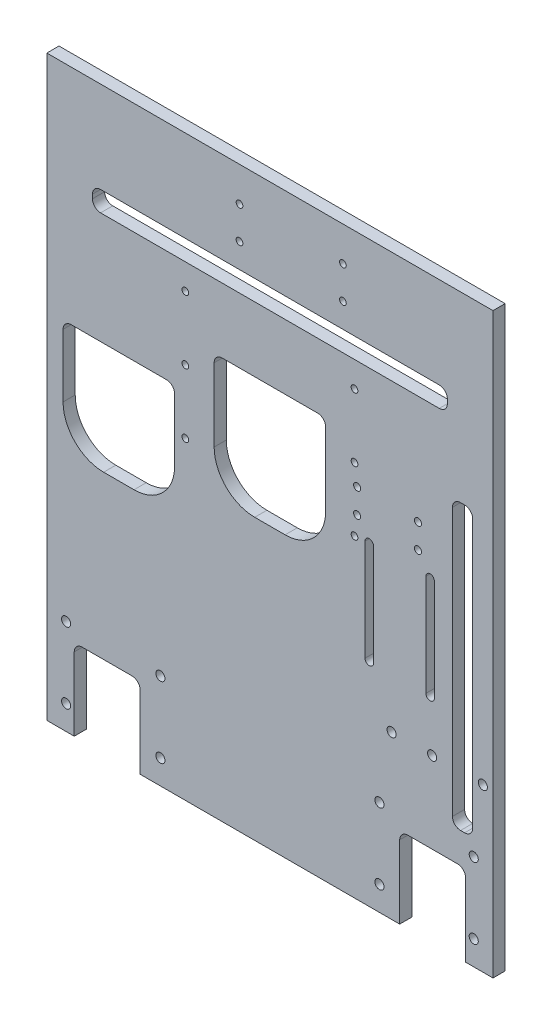
from build123d import *

# Parameters (mm, degrees)
ESQUISSE1_W                  = 220
ESQUISSE1_H                  = 285
BOSS_EXTRU_1_DEPTH           = 6
ESQUISSE2_R                  = 2
ENL_V_MAT_EXTRU_1_DEPTH      = 8
ENL_V_MAT_EXTRU_2_DEPTH      = 361.084712255
ENL_V_MAT_EXTRU_2_DEPTH_BACK = 361.084712255
ESQUISSE3_W                  = 55
ESQUISSE3_H                  = 60
ESQUISSE3_H_2                = 55
ESQUISSE3_W_2                = 10
ESQUISSE3_H_3                = 140
ENL_V_MAT_EXTRU_3_DEPTH      = 361.084712255
ENL_V_MAT_EXTRU_3_DEPTH_BACK = 361.084712255
ESQUISSE5_W                  = 175
ESQUISSE5_H                  = 10
ENL_V_MAT_EXTRU_4_DEPTH      = 361.084712255
ENL_V_MAT_EXTRU_4_DEPTH_BACK = 361.084712255
ESQUISSE6_R                  = 2.25
ESQUISSE6_R_2                = 1.75
ENL_V_MAT_EXTRU_5_DEPTH      = 361.084712255
ENL_V_MAT_EXTRU_5_DEPTH_BACK = 361.084712255
ESQUISSE7_R                  = 1.65
ENL_V_MAT_EXTRU_6_DEPTH      = 361.084712255
ENL_V_MAT_EXTRU_6_DEPTH_BACK = 361.084712255
ESQUISSE8_W                  = 32.5
ESQUISSE8_H                  = 40
CONG_1_R                     = 20
CONG_2_R                     = 4
ENL_V_MAT_EXTRU_7_DEPTH      = 361.084712255
ENL_V_MAT_EXTRU_7_DEPTH_BACK = 361.084712255
ENL_V_MAT_EXTRU_8_DEPTH      = 361.084712255
ENL_V_MAT_EXTRU_8_DEPTH_BACK = 361.084712255
ESQUISSE10_R                 = 2.25


with BuildPart() as part:
    # Esquisse1 → Boss.-Extru.1 (new body)
    with BuildSketch(Plane.XY):
        with Locations((110, 142.5)):
            Rectangle(ESQUISSE1_W, ESQUISSE1_H)
    extrude(amount=BOSS_EXTRU_1_DEPTH)

    # Esquisse2 → Enlèv. mat.-Extru.1 (cut)
    with BuildSketch(Plane.XZ):
        with Locations((110, 3)):
            Circle(ESQUISSE2_R)
        with Locations((213, 3)):
            Circle(ESQUISSE2_R)
        with Locations((7, 3)):
            Circle(ESQUISSE2_R)
    extrude(amount=-ENL_V_MAT_EXTRU_1_DEPTH, mode=Mode.SUBTRACT)

    # Esquisse3 → Enlèv. mat.-Extru.2 (cut, two sides: drawn at the far end of the back side and taken through both)
    with BuildSketch(Plane.XY.offset(6).offset(-ENL_V_MAT_EXTRU_2_DEPTH_BACK)):
        with Locations((110, 168)):
            Rectangle(ESQUISSE3_W, ESQUISSE3_H)
        with Locations((35.5, 147.5)):
            Rectangle(ESQUISSE3_W, ESQUISSE3_H_2)
        with Locations((205, 125)):
            Rectangle(ESQUISSE3_W_2, ESQUISSE3_H_3)
    extrude(amount=ENL_V_MAT_EXTRU_2_DEPTH + ENL_V_MAT_EXTRU_2_DEPTH_BACK, mode=Mode.SUBTRACT)

    # Esquisse5 → Enlèv. mat.-Extru.3 (cut, two sides: drawn at the far end of the back side and taken through both)
    with BuildSketch(Plane.XY.offset(6).offset(-ENL_V_MAT_EXTRU_3_DEPTH_BACK)):
        with Locations((110, 235)):
            Rectangle(ESQUISSE5_W, ESQUISSE5_H)
    extrude(amount=ENL_V_MAT_EXTRU_3_DEPTH + ENL_V_MAT_EXTRU_3_DEPTH_BACK, mode=Mode.SUBTRACT)

    # Esquisse6 → Enlèv. mat.-Extru.4 (cut, two sides: drawn at the far end of the back side and taken through both)
    with BuildSketch(Plane.XY.offset(6).offset(-ENL_V_MAT_EXTRU_4_DEPTH_BACK)):
        with Locations((190, 80)):
            Circle(ESQUISSE6_R)
        with Locations((170, 80)):
            Circle(ESQUISSE6_R)
        with Locations((215, 80)):
            Circle(ESQUISSE6_R)
        with Locations((153, 176.25)):
            Circle(ESQUISSE6_R_2)
        with Locations((183, 176.25)):
            Circle(ESQUISSE6_R_2)
        with Locations((183, 164.25)):
            Circle(ESQUISSE6_R_2)
        with Locations((153, 164.25)):
            Circle(ESQUISSE6_R_2)
    extrude(amount=ENL_V_MAT_EXTRU_4_DEPTH + ENL_V_MAT_EXTRU_4_DEPTH_BACK, mode=Mode.SUBTRACT)

    # Esquisse7 → Enlèv. mat.-Extru.5 (cut, two sides: drawn at the far end of the back side and taken through both)
    with BuildSketch(Plane.XY.offset(6).offset(-ENL_V_MAT_EXTRU_5_DEPTH_BACK)):
        with Locations((68.285, 217.4)):
            Circle(ESQUISSE7_R)
        with Locations((68.285, 186)):
            Circle(ESQUISSE7_R)
        with Locations((68.285, 154.6)):
            Circle(ESQUISSE7_R)
        with Locations((151.715, 154.6)):
            Circle(ESQUISSE7_R)
        with Locations((151.715, 186)):
            Circle(ESQUISSE7_R)
        with Locations((151.715, 217.4)):
            Circle(ESQUISSE7_R)
        with Locations((95, 268)):
            Circle(ESQUISSE7_R)
        with Locations((146, 268)):
            Circle(ESQUISSE7_R)
        with Locations((146, 252)):
            Circle(ESQUISSE7_R)
        with Locations((95, 252)):
            Circle(ESQUISSE7_R)
    extrude(amount=ENL_V_MAT_EXTRU_5_DEPTH + ENL_V_MAT_EXTRU_5_DEPTH_BACK, mode=Mode.SUBTRACT)

    # Esquisse8 → Enlèv. mat.-Extru.6 (cut, two sides: drawn at the far end of the back side and taken through both)
    with BuildSketch(Plane.XY.offset(6).offset(-ENL_V_MAT_EXTRU_6_DEPTH_BACK)):
        with Locations((190.25, 20)):
            Rectangle(ESQUISSE8_W, ESQUISSE8_H)
        with Locations((29.75, 20)):
            Rectangle(ESQUISSE8_W, ESQUISSE8_H)
    extrude(amount=ENL_V_MAT_EXTRU_6_DEPTH + ENL_V_MAT_EXTRU_6_DEPTH_BACK, mode=Mode.SUBTRACT)

    # Congé1
    cong_1_edges = [part.edges().sort_by_distance(p)[0] for p in [
        (137.5, 138, 3),
        (82.5, 138, 3),
        (63, 120, 3),
        (8, 120, 3),
    ]]
    fillet(cong_1_edges, radius=CONG_1_R)

    # Congé2
    cong_2_edges = [part.edges().sort_by_distance(p)[0] for p in [
        (137.5, 198, 3),
        (82.5, 198, 3),
        (197.5, 230, 3),
        (197.5, 240, 3),
        (22.5, 240, 3),
        (22.5, 230, 3),
        (63, 175, 3),
        (8, 175, 3),
        (200, 195, 3),
        (210, 195, 3),
        (210, 55, 3),
        (200, 55, 3),
        (206.5, 40, 3),
        (174, 40, 3),
        (46, 40, 3),
        (13.5, 40, 3),
    ]]
    fillet(cong_2_edges, radius=CONG_2_R)

    # Esquisse9 → Enlèv. mat.-Extru.7 (cut, two sides: drawn at the far end of the back side and taken through both)
    with BuildSketch(Plane.XY.offset(6).offset(-ENL_V_MAT_EXTRU_7_DEPTH_BACK)):
        with BuildLine():
            Line((191.1, 155), (191.1, 105))
            ThreePointArc((191.1, 105), (189, 102.9), (186.9, 105))
            Line((186.9, 105), (186.9, 155))
            ThreePointArc((186.9, 155), (189, 157.1), (191.1, 155))
        make_face()
        with BuildLine():
            Line((156.9, 105), (156.9, 155))
            ThreePointArc((156.9, 155), (159, 157.1), (161.1, 155))
            Line((161.1, 155), (161.1, 105))
            ThreePointArc((161.1, 105), (159, 102.9), (156.9, 105))
        make_face()
    extrude(amount=ENL_V_MAT_EXTRU_7_DEPTH + ENL_V_MAT_EXTRU_7_DEPTH_BACK, mode=Mode.SUBTRACT)

    # Esquisse10 → Enlèv. mat.-Extru.8 (cut, two sides: drawn at the far end of the back side and taken through both)
    with BuildSketch(Plane.XY.offset(6).offset(-ENL_V_MAT_EXTRU_8_DEPTH_BACK)):
        with Locations((9.5, 12)):
            Circle(ESQUISSE10_R)
        with Locations((9.5, 47)):
            Circle(ESQUISSE10_R)
        with Locations((210.5, 47)):
            Circle(ESQUISSE10_R)
        with Locations((210.5, 12)):
            Circle(ESQUISSE10_R)
        with Locations((56, 47)):
            Circle(ESQUISSE10_R)
        with Locations((56, 12)):
            Circle(ESQUISSE10_R)
        with Locations((164, 12)):
            Circle(ESQUISSE10_R)
        with Locations((164, 47)):
            Circle(ESQUISSE10_R)
    extrude(amount=ENL_V_MAT_EXTRU_8_DEPTH + ENL_V_MAT_EXTRU_8_DEPTH_BACK, mode=Mode.SUBTRACT)


solid = part.part
